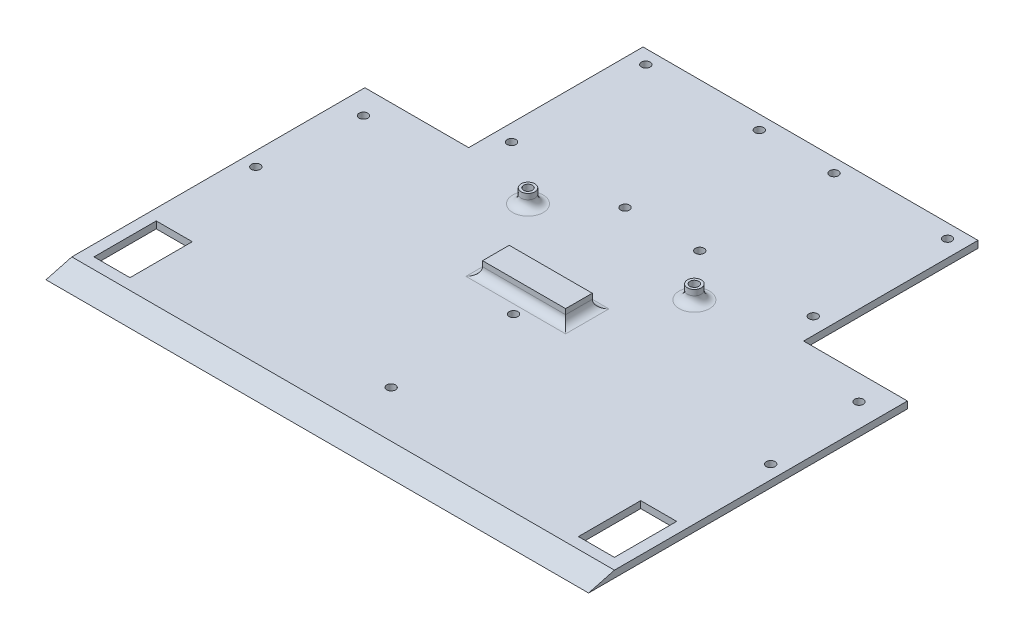
from build123d import *

# Parameters (mm, degrees)
SALIENTE_EXTRUIR1_DEPTH = 196
CORTAR_EXTRUIR1_REACH   = 266.89
CROQUIS2_W              = 37.5
CROQUIS2_H              = 62.989872981
CORTAR_EXTRUIR2_REACH   = 266.89
CROQUIS4_W              = 13
CROQUIS4_H              = 22.5
CUT_EXTRUDE1_REACH      = 266.89
SKETCH1_R               = 1.585
CUT_EXTRUDE2_REACH      = 266.89
SKETCH2_R               = 1.585
CUT_EXTRUDE3_REACH      = 266.89
SKETCH3_R               = 1.585
SKETCH4_R               = 2.5
SKETCH4_R_2             = 1.6
BOSS_EXTRUDE1_DEPTH     = 5
SKETCH5_W               = 30
SKETCH5_H               = 9.637731071
BOSS_EXTRUDE2_DEPTH     = 4.9
CUT_EXTRUDE4_START      = -4.9
SKETCH6_R               = 1.6
CUT_EXTRUDE4_DEPTH      = 4.9
SKETCH7_R               = 1.585
CUT_EXTRUDE5_DEPTH      = 10
FILLET1_R               = 3


with BuildPart() as part:
    # Croquis1 → Saliente-Extruir1 (new body)
    with BuildSketch(Plane(origin=(0, 0, 0), x_dir=(0, 0, -1), z_dir=(1, 0, 0))):
        Polygon((0, 0), (178.17, 0), (178.17, 2.5), (9.330127019, 2.5), align=None)
    extrude(amount=SALIENTE_EXTRUIR1_DEPTH)

    # Croquis2 → Cortar-Extruir1 (cut, up to next)
    with BuildSketch(Plane(origin=(0, 0, 0), x_dir=(-1, 0, 0), z_dir=(0, -1, 0)), mode=Mode.PRIVATE) as cortar_extruir1_sk1:
        with Locations((-18.75, 146.67506351)):
            Rectangle(CROQUIS2_W, CROQUIS2_H)
    cortar_extruir1_tool1 = extrude(cortar_extruir1_sk1.sketch, amount=-CORTAR_EXTRUIR1_REACH, mode=Mode.PRIVATE) & part.part
    # Croquis2 → Cortar-Extruir1 (cut, up to next)
    with BuildSketch(Plane(origin=(0, 0, 0), x_dir=(-1, 0, 0), z_dir=(0, -1, 0)), mode=Mode.PRIVATE) as cortar_extruir1_sk2:
        with Locations((-177.25, 146.67506351)):
            Rectangle(CROQUIS2_W, CROQUIS2_H)
    cortar_extruir1_tool2 = extrude(cortar_extruir1_sk2.sketch, amount=-CORTAR_EXTRUIR1_REACH, mode=Mode.PRIVATE) & part.part
    add(cortar_extruir1_tool1.solids().sort_by_distance((18.75, 0, -146.675064))[0], mode=Mode.SUBTRACT)
    add(cortar_extruir1_tool2.solids().sort_by_distance((177.25, 0, -146.675064))[0], mode=Mode.SUBTRACT)

    # Croquis4 → Cortar-Extruir2 (cut, up to next)
    with BuildSketch(Plane(origin=(0, 2.5, 0), x_dir=(1, 0, 0), z_dir=(0, 1, 0)), mode=Mode.PRIVATE) as cortar_extruir2_sk1:
        with Locations((10.5, 24.580127019)):
            Rectangle(CROQUIS4_W, CROQUIS4_H)
    cortar_extruir2_tool1 = extrude(cortar_extruir2_sk1.sketch, amount=-CORTAR_EXTRUIR2_REACH, mode=Mode.PRIVATE) & part.part
    cortar_extruir2 = cortar_extruir2_tool1.solids().sort_by_distance((10.5, 2.5, -24.580127))[0]
    add(cortar_extruir2, mode=Mode.SUBTRACT)

    # Simetría1: Cortar-Extruir2 across plane
    add(cortar_extruir2.mirror(Plane(origin=(98, 0, 0), x_dir=(0, 0, 1), z_dir=(1, 0, 0))), mode=Mode.SUBTRACT)

    # Sketch1 → Cut-Extrude1 (cut, up to next)
    with BuildSketch(Plane(origin=(0, 2.5, 0), x_dir=(1, 0, 0), z_dir=(0, 1, 0)), mode=Mode.PRIVATE) as cut_extrude1_sk1:
        with Locations((187.5, 106.180127019)):
            Circle(SKETCH1_R)
    cut_extrude1_tool1 = extrude(cut_extrude1_sk1.sketch, amount=-CUT_EXTRUDE1_REACH, mode=Mode.PRIVATE) & part.part
    # Sketch1 → Cut-Extrude1 (cut, up to next)
    with BuildSketch(Plane(origin=(0, 2.5, 0), x_dir=(1, 0, 0), z_dir=(0, 1, 0)), mode=Mode.PRIVATE) as cut_extrude1_sk2:
        with Locations((8.5, 106.180127019)):
            Circle(SKETCH1_R)
    cut_extrude1_tool2 = extrude(cut_extrude1_sk2.sketch, amount=-CUT_EXTRUDE1_REACH, mode=Mode.PRIVATE) & part.part
    add(cut_extrude1_tool1.solids().sort_by_distance((187.5, 2.5, -106.180127))[0], mode=Mode.SUBTRACT)
    add(cut_extrude1_tool2.solids().sort_by_distance((8.5, 2.5, -106.180127))[0], mode=Mode.SUBTRACT)

    # Sketch2 → Cut-Extrude2 (cut, up to next)
    with BuildSketch(Plane(origin=(0, 2.5, 0), x_dir=(1, 0, 0), z_dir=(0, 1, 0)), mode=Mode.PRIVATE) as cut_extrude2_sk1:
        with Locations((98.5, 26.180127019)):
            Circle(SKETCH2_R)
    cut_extrude2_tool1 = extrude(cut_extrude2_sk1.sketch, amount=-CUT_EXTRUDE2_REACH, mode=Mode.PRIVATE) & part.part
    add(cut_extrude2_tool1.solids().sort_by_distance((98.5, 2.5, -26.180127))[0], mode=Mode.SUBTRACT)

    # Sketch3 → Cut-Extrude3 (cut, up to next)
    with BuildSketch(Plane(origin=(0, 2.5, 0), x_dir=(1, 0, 0), z_dir=(0, 1, 0)), mode=Mode.PRIVATE) as cut_extrude3_sk1:
        with Locations((111.5, 124.67)):
            Circle(SKETCH3_R)
    cut_extrude3_tool1 = extrude(cut_extrude3_sk1.sketch, amount=-CUT_EXTRUDE3_REACH, mode=Mode.PRIVATE) & part.part
    # Sketch3 → Cut-Extrude3 (cut, up to next)
    with BuildSketch(Plane(origin=(0, 2.5, 0), x_dir=(1, 0, 0), z_dir=(0, 1, 0)), mode=Mode.PRIVATE) as cut_extrude3_sk2:
        with Locations((152.5, 124.67)):
            Circle(SKETCH3_R)
    cut_extrude3_tool2 = extrude(cut_extrude3_sk2.sketch, amount=-CUT_EXTRUDE3_REACH, mode=Mode.PRIVATE) & part.part
    # Sketch3 → Cut-Extrude3 (cut, up to next)
    with BuildSketch(Plane(origin=(0, 2.5, 0), x_dir=(1, 0, 0), z_dir=(0, 1, 0)), mode=Mode.PRIVATE) as cut_extrude3_sk3:
        with Locations((152.5, 173.17)):
            Circle(SKETCH3_R)
    cut_extrude3_tool3 = extrude(cut_extrude3_sk3.sketch, amount=-CUT_EXTRUDE3_REACH, mode=Mode.PRIVATE) & part.part
    # Sketch3 → Cut-Extrude3 (cut, up to next)
    with BuildSketch(Plane(origin=(0, 2.5, 0), x_dir=(1, 0, 0), z_dir=(0, 1, 0)), mode=Mode.PRIVATE) as cut_extrude3_sk4:
        with Locations((111.5, 173.17)):
            Circle(SKETCH3_R)
    cut_extrude3_tool4 = extrude(cut_extrude3_sk4.sketch, amount=-CUT_EXTRUDE3_REACH, mode=Mode.PRIVATE) & part.part
    # Sketch3 → Cut-Extrude3 (cut, up to next)
    with BuildSketch(Plane(origin=(0, 2.5, 0), x_dir=(1, 0, 0), z_dir=(0, 1, 0)), mode=Mode.PRIVATE) as cut_extrude3_sk5:
        with Locations((84.5, 173.17)):
            Circle(SKETCH3_R)
    cut_extrude3_tool5 = extrude(cut_extrude3_sk5.sketch, amount=-CUT_EXTRUDE3_REACH, mode=Mode.PRIVATE) & part.part
    # Sketch3 → Cut-Extrude3 (cut, up to next)
    with BuildSketch(Plane(origin=(0, 2.5, 0), x_dir=(1, 0, 0), z_dir=(0, 1, 0)), mode=Mode.PRIVATE) as cut_extrude3_sk6:
        with Locations((43.5, 173.17)):
            Circle(SKETCH3_R)
    cut_extrude3_tool6 = extrude(cut_extrude3_sk6.sketch, amount=-CUT_EXTRUDE3_REACH, mode=Mode.PRIVATE) & part.part
    # Sketch3 → Cut-Extrude3 (cut, up to next)
    with BuildSketch(Plane(origin=(0, 2.5, 0), x_dir=(1, 0, 0), z_dir=(0, 1, 0)), mode=Mode.PRIVATE) as cut_extrude3_sk7:
        with Locations((43.5, 124.67)):
            Circle(SKETCH3_R)
    cut_extrude3_tool7 = extrude(cut_extrude3_sk7.sketch, amount=-CUT_EXTRUDE3_REACH, mode=Mode.PRIVATE) & part.part
    # Sketch3 → Cut-Extrude3 (cut, up to next)
    with BuildSketch(Plane(origin=(0, 2.5, 0), x_dir=(1, 0, 0), z_dir=(0, 1, 0)), mode=Mode.PRIVATE) as cut_extrude3_sk8:
        with Locations((84.5, 124.67)):
            Circle(SKETCH3_R)
    cut_extrude3_tool8 = extrude(cut_extrude3_sk8.sketch, amount=-CUT_EXTRUDE3_REACH, mode=Mode.PRIVATE) & part.part
    add(cut_extrude3_tool1.solids().sort_by_distance((111.5, 2.5, -124.67))[0], mode=Mode.SUBTRACT)
    add(cut_extrude3_tool2.solids().sort_by_distance((152.5, 2.5, -124.67))[0], mode=Mode.SUBTRACT)
    add(cut_extrude3_tool3.solids().sort_by_distance((152.5, 2.5, -173.17))[0], mode=Mode.SUBTRACT)
    add(cut_extrude3_tool4.solids().sort_by_distance((111.5, 2.5, -173.17))[0], mode=Mode.SUBTRACT)
    add(cut_extrude3_tool5.solids().sort_by_distance((84.5, 2.5, -173.17))[0], mode=Mode.SUBTRACT)
    add(cut_extrude3_tool6.solids().sort_by_distance((43.5, 2.5, -173.17))[0], mode=Mode.SUBTRACT)
    add(cut_extrude3_tool7.solids().sort_by_distance((43.5, 2.5, -124.67))[0], mode=Mode.SUBTRACT)
    add(cut_extrude3_tool8.solids().sort_by_distance((84.5, 2.5, -124.67))[0], mode=Mode.SUBTRACT)

    # Sketch4 → Boss-Extrude1 (add)
    # profile 1 of 2: a face of its own
    with BuildSketch(Plane(origin=(0, 2.5, 0), x_dir=(1, 0, 0), z_dir=(0, 1, 0))):
        with Locations((65.776416732, 108.336862559)):
            Circle(SKETCH4_R)
        with Locations((65.776416732, 108.336862559)):
            Circle(SKETCH4_R_2, mode=Mode.SUBTRACT)
    # profile 2 of 2: a face of its own
    with BuildSketch(Plane(origin=(0, 2.5, 0), x_dir=(1, 0, 0), z_dir=(0, 1, 0))):
        with Locations((125.876416732, 108.336862559)):
            Circle(SKETCH4_R)
        with Locations((125.876416732, 108.336862559)):
            Circle(SKETCH4_R_2, mode=Mode.SUBTRACT)
    extrude(amount=BOSS_EXTRUDE1_DEPTH)

    # Sketch5 → Boss-Extrude2 (add)
    with BuildSketch(Plane(origin=(0, 2.5, 0), x_dir=(1, 0, 0), z_dir=(0, 1, 0))):
        with Locations((95.271957283, 82.2427394)):
            Rectangle(SKETCH5_W, SKETCH5_H)
    extrude(amount=BOSS_EXTRUDE2_DEPTH)

    # Sketch6 → Cut-Extrude4 (cut)
    with BuildSketch(Plane(origin=(0, 2.5, 0), x_dir=(1, 0, 0), z_dir=(0, 1, 0)).offset(CUT_EXTRUDE4_START)):
        with Locations((125.876416732, 108.336862559)):
            Circle(SKETCH6_R)
        with Locations((65.776416732, 108.336862559)):
            Circle(SKETCH6_R)
    extrude(amount=CUT_EXTRUDE4_DEPTH, mode=Mode.SUBTRACT)

    # Sketch7 → Cut-Extrude5 (cut)
    with BuildSketch(Plane(origin=(0, 2.5, 0), x_dir=(1, 0, 0), z_dir=(0, 1, 0))):
        with Locations((5.067111952, 70.727811806)):
            Circle(SKETCH7_R)
        with Locations((97.681935477, 71.208529763)):
            Circle(SKETCH7_R)
        with Locations((191.067111952, 70.727811806)):
            Circle(SKETCH7_R)
    extrude(amount=-CUT_EXTRUDE5_DEPTH, mode=Mode.SUBTRACT)

    # Fillet1
    fillet1_edges = [part.edges().sort_by_distance(p)[0] for p in [
        (80.271957283, 2.5, -82.242739401),
        (95.271957283, 2.5, -87.061604936),
        (110.271957283, 2.5, -82.242739401),
        (95.271957283, 2.5, -77.423873865),
        (63.276416732, 2.5, -108.336862559),
        (123.376416732, 2.5, -108.336862559),
    ]]
    fillet(fillet1_edges, radius=FILLET1_R)


solid = part.part
